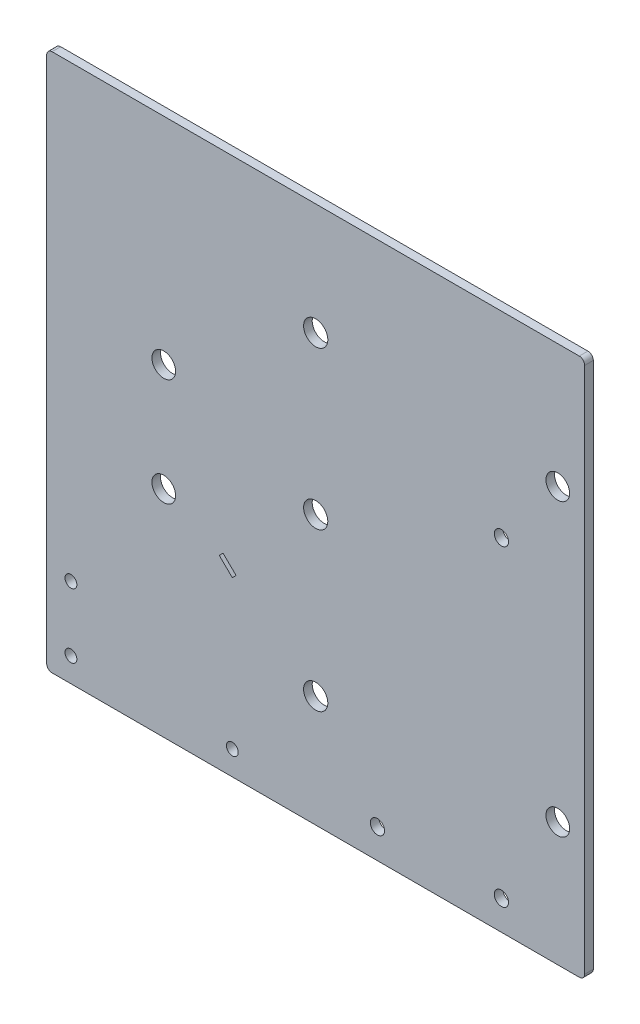
from build123d import *

# Parameters (mm, degrees)
SKETCH1_W           = 100
SKETCH1_H           = 100
BOSS_EXTRUDE1_DEPTH = 1.6
SKETCH3_R           = 2.2479
SKETCH3_R_2         = 1.325
SKETCH3_R_3         = 2.25
SKETCH3_R_4         = 2.2
SKETCH3_R_5         = 1.1
CUT_EXTRUDE2_DEPTH  = 71.728777736
FILLET1_R           = 1
CUT_EXTRUDE4_DEPTH  = 71.728777736


with BuildPart() as part:
    # Sketch1 → Boss-Extrude1 (new body)
    with BuildSketch(Plane.XY):
        Rectangle(SKETCH1_W, SKETCH1_H)
    extrude(amount=BOSS_EXTRUDE1_DEPTH)

    # Sketch3 → Cut-Extrude2 (cut, through all)
    with BuildSketch(Plane(origin=(0, 0, 1.6), x_dir=(-1, 0, 0), z_dir=(0, 0, -1))):
        Circle(SKETCH3_R)
        with Locations((-34.525, -44.525)):
            Circle(SKETCH3_R_2)
        with Locations((0, -29.25)):
            Circle(SKETCH3_R_3)
        with Locations((-45, -27)):
            Circle(SKETCH3_R_4)
        with Locations((0, 29.25)):
            Circle(SKETCH3_R_3)
        with Locations((-45, 27)):
            Circle(SKETCH3_R_4)
        with Locations((-34.525, 13.525)):
            Circle(SKETCH3_R_2)
        with Locations((15.5, -45.5)):
            Circle(SKETCH3_R_5)
        with Locations((45.5, -45.5)):
            Circle(SKETCH3_R_5)
        with Locations((45.5, -33.5)):
            Circle(SKETCH3_R_5)
        with Locations((-11.475, -44.525)):
            Circle(SKETCH3_R_2)
        with Locations((28.244666378, -9.999429886)):
            Circle(SKETCH3_R_4)
        with Locations((28.244666378, 10.000570114)):
            Circle(SKETCH3_R_4)
    extrude(amount=CUT_EXTRUDE2_DEPTH, mode=Mode.SUBTRACT)

    # Fillet1
    fillet1_edges = [part.edges().sort_by_distance(p)[0] for p in [
        (-50, -50, 0.8),
        (-50, 50, 0.8),
        (50, -50, 0.8),
        (50, 50, 0.8),
    ]]
    fillet(fillet1_edges, radius=FILLET1_R)

    # Sketch5 → Cut-Extrude4 (cut, through all)
    with BuildSketch(Plane(origin=(0, 0, 0), x_dir=(-1, 0, 0), z_dir=(0, 0, -1))):
        Polygon((14.795844999, -17.2148435), (17.226691328, -14.82972505), (17.927052517, -15.543513678), (15.496206188, -17.928632127), align=None)
    extrude(amount=-CUT_EXTRUDE4_DEPTH, mode=Mode.SUBTRACT)


solid = part.part
